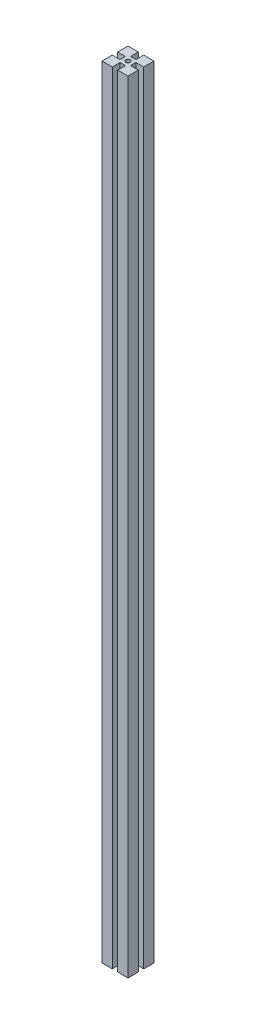
from build123d import *

# Parameters (mm, degrees)
AUFSATZ_LINEAR_AUSTRAGEN1_DEPTH = 1200
SKIZZE2_R                       = 3.45
SCHNITT_LINEAR_AUSTRAGEN1_DEPTH = 30


with BuildPart() as part:
    # Skizze1 → Aufsatz-Linear austragen1 (new body)
    with BuildSketch(Plane(origin=(0, 0, 0), x_dir=(1, 0, 0), z_dir=(0, 1, 0))):
        Polygon((-4.1, -20), (-4.1, -8), (4.1, -8), (4.1, -20), (20, -20), (20, -4.1), (8, -4.1), (8, 4.1), (20, 4.1), (20, 20), (4.1, 20), (4.1, 8), (-4.1, 8), (-4.1, 20), (-20, 20), (-20, 4.1), (-8, 4.1), (-8, -4.1), (-20, -4.1), (-20, -20), align=None)
    extrude(amount=AUFSATZ_LINEAR_AUSTRAGEN1_DEPTH)

    # Skizze2 → Schnitt-Linear austragen1 (cut)
    with BuildSketch(Plane(origin=(0, 1200, 0), x_dir=(1, 0, 0), z_dir=(0, 1, 0))):
        Circle(SKIZZE2_R)
    extrude(amount=-SCHNITT_LINEAR_AUSTRAGEN1_DEPTH, mode=Mode.SUBTRACT)


solid = part.part
